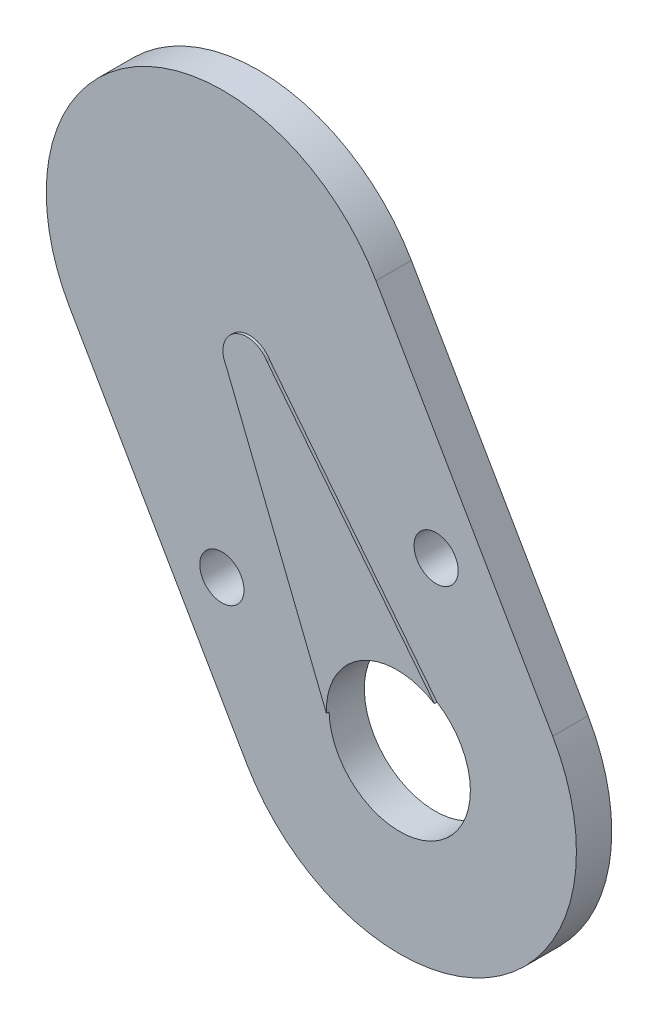
from build123d import *

# Parameters (mm, degrees)
RETAINER_PLATE_2MM_START         = -2
RETAINER_PLATE_2MM_DEPTH         = 2
RETAINER_PLATE_2MM_ROOT_START    = -2
SKETCH_2_R                       = 10
RETAINER_PLATE_2MM_ROOT_DEPTH    = 2
RETAINER_PLATE_2MM_TIP_START     = -2
SKETCH_3_R                       = 10
RETAINER_PLATE_2MM_TIP_DEPTH     = 2
HORN_CONTACT_PAD_0P15_DEPTH      = 0.15
SKETCH_5_R                       = 3.8
HORN_CONTACT_PAD_0P15_ROOT_DEPTH = 0.15
SKETCH_6_R                       = 1.35
HORN_CONTACT_PAD_0P15_TIP_DEPTH  = 0.15
BOSS_CLEARANCE_8_START           = -2.1
SKETCH_7_R                       = 4
BOSS_CLEARANCE_8_DEPTH           = 2.5
M2_CLEARANCE_2P5_PITCH14_START   = -2.1
SKETCH_8_R                       = 1.25
M2_CLEARANCE_2P5_PITCH14_DEPTH   = 2.5


with BuildPart() as part:
    # 草图1 → Retainer_plate_2mm (new body)
    with BuildSketch(Plane.XY.offset(RETAINER_PLATE_2MM_START)):
        Polygon((8.660254038, 5), (-1.339745962, 22.320508076), (-18.660254038, 12.320508076), (-8.660254038, -5), align=None)
    extrude(amount=RETAINER_PLATE_2MM_DEPTH)

    # 草图2 → Retainer_plate_2mm_root (add)
    with BuildSketch(Plane.XY.offset(RETAINER_PLATE_2MM_ROOT_START)):
        Circle(SKETCH_2_R)
    extrude(amount=RETAINER_PLATE_2MM_ROOT_DEPTH)

    # 草图3 → Retainer_plate_2mm_tip (add)
    with BuildSketch(Plane.XY.offset(RETAINER_PLATE_2MM_TIP_START)):
        with Locations((-10, 17.320508076)):
            Circle(SKETCH_3_R)
    extrude(amount=RETAINER_PLATE_2MM_TIP_DEPTH)

    # 草图4 → Horn_contact_pad_0p15 (add)
    with BuildSketch(Plane.XY):
        Polygon((3.290896534, 1.9), (-7.330865705, 15.397431864), (-9.669134295, 14.047431864), (-3.290896534, -1.9), align=None)
    extrude(amount=HORN_CONTACT_PAD_0P15_DEPTH)

    # 草图5 → Horn_contact_pad_0p15_root (add)
    with BuildSketch(Plane.XY):
        Circle(SKETCH_5_R)
    extrude(amount=HORN_CONTACT_PAD_0P15_ROOT_DEPTH)

    # 草图6 → Horn_contact_pad_0p15_tip (add)
    with BuildSketch(Plane.XY):
        with Locations((-8.5, 14.722431864)):
            Circle(SKETCH_6_R)
    extrude(amount=HORN_CONTACT_PAD_0P15_TIP_DEPTH)

    # 草图7 → Boss_clearance_8 (cut)
    with BuildSketch(Plane.XY.offset(BOSS_CLEARANCE_8_START)):
        Circle(SKETCH_7_R)
    extrude(amount=BOSS_CLEARANCE_8_DEPTH, mode=Mode.SUBTRACT)

    # 草图8 → M2_clearance_2p5_pitch14 (cut)
    with BuildSketch(Plane.XY.offset(M2_CLEARANCE_2P5_PITCH14_START)):
        with Locations((2.062177826, 10.42820323)):
            Circle(SKETCH_8_R)
        with Locations((-10.062177826, 3.42820323)):
            Circle(SKETCH_8_R)
    extrude(amount=M2_CLEARANCE_2P5_PITCH14_DEPTH, mode=Mode.SUBTRACT)


solid = part.part
